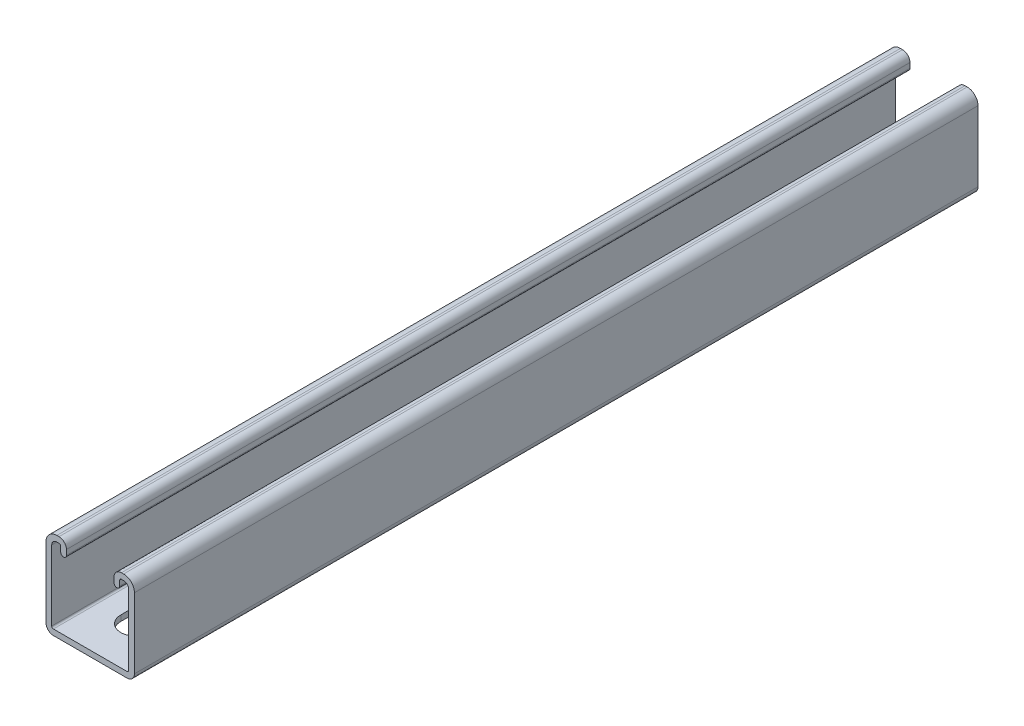
from build123d import *

# Parameters (mm, degrees)
PRIMARY_EXTRUSION_DEPTH = 393.7
SLOT_CUT_REACH          = 398.395
LPATTERN1_COUNT         = 8
LPATTERN1_PITCH         = 50.8


with BuildPart() as part:
    # Sketch1 → Primary Extrusion (new body)
    with BuildSketch(Plane.XY):
        with BuildLine():
            Line((17.176891111, -17.970376528), (-17.176891111, -17.970376528))
            ThreePointArc((-17.176891111, -17.970376528), (-17.738157147, -17.737892523), (-17.970641152, -17.176626487))
            Line((-17.970641152, -17.176626487), (-17.970641152, 15.589126408))
            ThreePointArc((-17.970641152, 15.589126408), (-17.273189139, 17.272924515), (-15.589391032, 17.970376528))
            Line((-15.589391032, 17.970376528), (-14.57342631, 17.970376528))
            ThreePointArc((-14.57342631, 17.970376528), (-14.012171972, 17.737897369), (-13.779692813, 17.176643031))
            Line((-13.779692813, 17.176643031), (-13.779692813, 14.833457753))
            ThreePointArc((-13.779692813, 14.833457753), (-12.446175174, 13.499940114), (-11.112657535, 14.833457753))
            Line((-11.112657535, 14.833457753), (-11.112657535, 17.176643031))
            ThreePointArc((-11.112657535, 17.176643031), (-12.126293241, 19.623776099), (-14.57342631, 20.637411806))
            Line((-14.57342631, 20.637411806), (-15.589391032, 20.637411806))
            ThreePointArc((-15.589391032, 20.637411806), (-19.15906787, 19.158803246), (-20.637676429, 15.589126408))
            Line((-20.637676429, 15.589126408), (-20.637676429, -17.176626487))
            ThreePointArc((-20.637676429, -17.176626487), (-19.624035878, -19.623771254), (-17.176891111, -20.637411806))
            Line((-17.176891111, -20.637411806), (17.176891111, -20.637411806))
            ThreePointArc((17.176891111, -20.637411806), (19.624035878, -19.623771254), (20.637676429, -17.176626487))
            Line((20.637676429, -17.176626487), (20.637676429, 15.589126408))
            ThreePointArc((20.637676429, 15.589126408), (19.15906787, 19.158803246), (15.589391032, 20.637411806))
            Line((15.589391032, 20.637411806), (14.57342631, 20.637411806))
            ThreePointArc((14.57342631, 20.637411806), (12.126293241, 19.623776099), (11.112657535, 17.176643031))
            Line((11.112657535, 17.176643031), (11.112657535, 14.833457753))
            ThreePointArc((11.112657535, 14.833457753), (12.446175174, 13.499940114), (13.779692813, 14.833457753))
            Line((13.779692813, 14.833457753), (13.779692813, 17.176643031))
            ThreePointArc((13.779692813, 17.176643031), (14.012171972, 17.737897369), (14.57342631, 17.970376528))
            Line((14.57342631, 17.970376528), (15.589391032, 17.970376528))
            ThreePointArc((15.589391032, 17.970376528), (17.273189139, 17.272924515), (17.970641152, 15.589126408))
            Line((17.970641152, 15.589126408), (17.970641152, -17.176626487))
            ThreePointArc((17.970641152, -17.176626487), (17.738157147, -17.737892523), (17.176891111, -17.970376528))
        make_face()
    extrude(amount=-PRIMARY_EXTRUSION_DEPTH)

    # Sketch58 → Slot Cut (cut, up to next)
    with BuildSketch(Plane(origin=(0, -20.637411806, 0), x_dir=(-1, 0, 0), z_dir=(0, 1, 0)), mode=Mode.PRIVATE) as slot_cut_sk1:
        with BuildLine():
            Line((7.14375, -29.36875), (7.14375, -21.43125))
            ThreePointArc((7.14375, -21.43125), (0, -14.2875), (-7.14375, -21.43125))
            Line((-7.14375, -21.43125), (-7.14375, -29.36875))
            ThreePointArc((-7.14375, -29.36875), (0, -36.5125), (7.14375, -29.36875))
        make_face()
    slot_cut_tool1 = extrude(slot_cut_sk1.sketch, amount=SLOT_CUT_REACH, mode=Mode.PRIVATE) & part.part
    slot_cut = slot_cut_tool1.solids().sort_by_distance((0, -20.637412, -25.4))[0]
    add(slot_cut, mode=Mode.SUBTRACT)

    # LPattern1: Slot Cut ×8
    with Locations(*[(0, 0, -i * LPATTERN1_PITCH) for i in range(1, LPATTERN1_COUNT)]):
        add(slot_cut, mode=Mode.SUBTRACT)


solid = part.part
